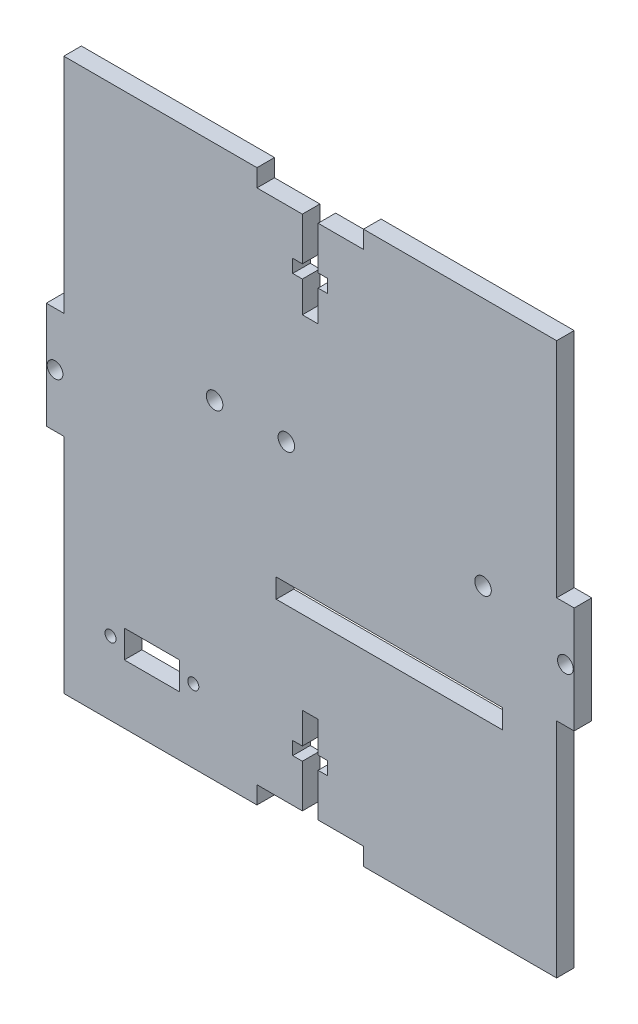
from build123d import *

# Parameters (mm, degrees)
BOSS_EXTRUDE1_DEPTH = 3.18
SKETCH18_W          = 3.18
SKETCH18_H          = 19.3
BOSS_EXTRUDE8_DEPTH = 3.18
SKETCH19_R          = 1.425
CUT_EXTRUDE8_DEPTH  = 70.262854583
CUT_EXTRUDE13_DEPTH = 70.262854583
SKETCH31_R          = 1.5
SKETCH31_W          = 41
SKETCH31_H          = 3.5
CUT_EXTRUDE16_DEPTH = 70.262854583
SKETCH36_R          = 1
SKETCH36_W          = 10
SKETCH36_H          = 5
CUT_EXTRUDE27_DEPTH = 70.262854583


with BuildPart() as part:
    # Sketch1 → Boss-Extrude1 (new body)
    with BuildSketch(Plane.XY):
        Polygon((-44.645, 50), (-14.881666667, 50), (14.881666667, 50), (44.645, 50), (44.645, -50), (-44.645, -50), align=None)
    extrude(amount=BOSS_EXTRUDE1_DEPTH)

    # Sketch18 → Boss-Extrude8 (add)
    with BuildSketch(Plane(origin=(44.645, 0, 0), x_dir=(0, 0, -1), z_dir=(1, 0, 0))):
        with Locations((-1.59, 0)):
            Rectangle(SKETCH18_W, SKETCH18_H)
    boss_extrude8 = extrude(amount=BOSS_EXTRUDE8_DEPTH)

    # Sketch19 → Cut-Extrude8 (cut, through all)
    with BuildSketch(Plane.XY.offset(3.18)):
        with Locations((46.235, 0)):
            Circle(SKETCH19_R)
    cut_extrude8 = extrude(amount=-CUT_EXTRUDE8_DEPTH, mode=Mode.SUBTRACT)

    # Mirror2: Boss-Extrude8, Cut-Extrude8 across plane
    add(boss_extrude8.mirror(Plane(origin=(0, 0, 0), x_dir=(0, 0, 1), z_dir=(1, 0, 0))))
    add(cut_extrude8.mirror(Plane(origin=(0, 0, 0), x_dir=(0, 0, 1), z_dir=(1, 0, 0))), mode=Mode.SUBTRACT)

    # Sketch26 → Cut-Extrude13 (cut, through all)
    with BuildSketch(Plane.XY.offset(3.18)):
        Polygon((-9.65, 50), (9.65, 50), (9.65, 46.82), (1.425, 46.82), (1.425, 39.02), (3.175, 39.02), (3.175, 36.64), (1.425, 36.64), (1.425, 31.02), (-1.425, 31.02), (-1.425, 36.64), (-3.175, 36.64), (-3.175, 39.02), (-1.425, 39.02), (-1.425, 46.82), (-9.65, 46.82), align=None)
    cut_extrude13 = extrude(amount=-CUT_EXTRUDE13_DEPTH, mode=Mode.SUBTRACT)

    # Mirror7: Cut-Extrude13 across plane
    add(cut_extrude13.mirror(Plane.ZX), mode=Mode.SUBTRACT)

    # Sketch31 → Cut-Extrude16 (cut, through all)
    with BuildSketch(Plane.XY.offset(3.18)):
        with Locations((-17.325, 9.65)):
            Circle(SKETCH31_R)
        with Locations((31.306146823, 4.864159796)):
            Circle(SKETCH31_R)
        with Locations((-4.325, 9.65)):
            Circle(SKETCH31_R)
        with Locations((14.3410024, -14.225840204)):
            Rectangle(SKETCH31_W, SKETCH31_H)
    extrude(amount=-CUT_EXTRUDE16_DEPTH, mode=Mode.SUBTRACT)

    # Sketch36 → Cut-Extrude27 (cut, through all)
    with BuildSketch(Plane.XY.offset(3.18)):
        with Locations((-21.181648121, -36.756808674)):
            Circle(SKETCH36_R)
        with Locations((-36.181648121, -36.756808674)):
            Circle(SKETCH36_R)
        with Locations((-28.681648121, -36.756808674)):
            Rectangle(SKETCH36_W, SKETCH36_H)
    extrude(amount=-CUT_EXTRUDE27_DEPTH, mode=Mode.SUBTRACT)


solid = part.part
